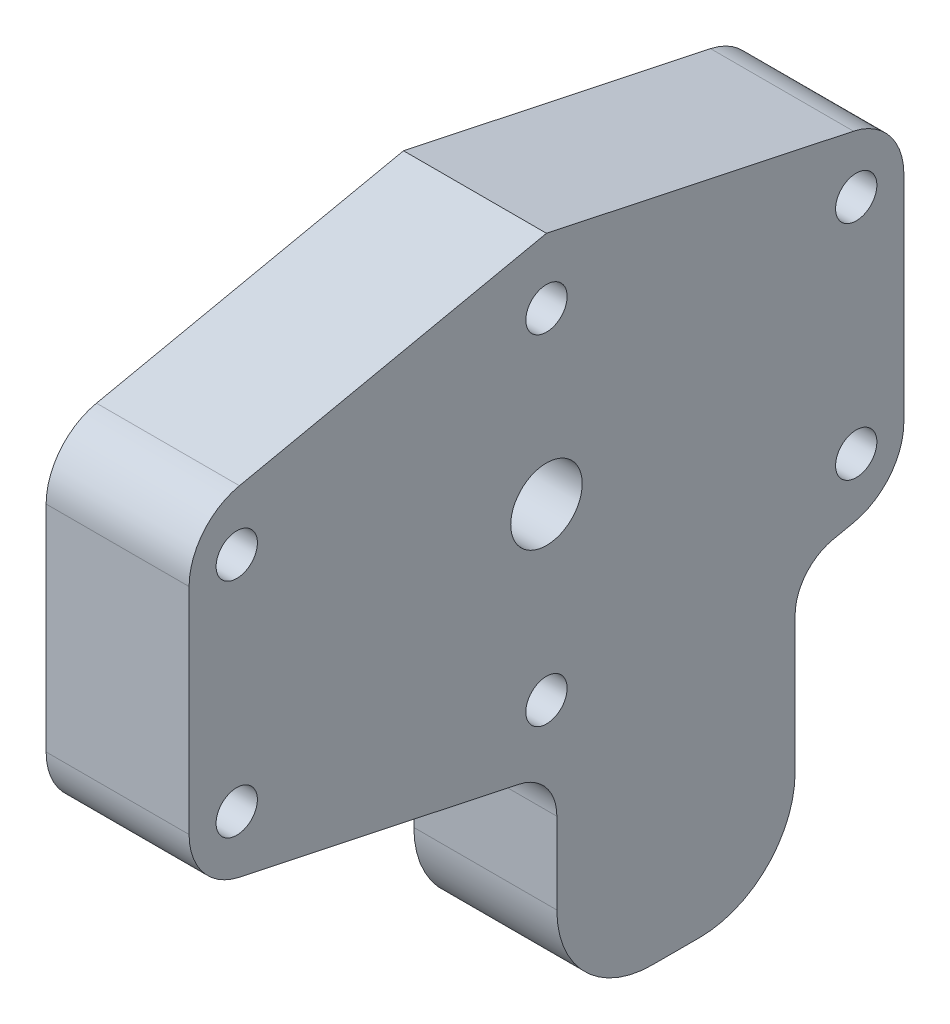
from build123d import *

# Parameters (mm, degrees)
SKETCH1_R           = 1.3
BOSS_EXTRUDE1_DEPTH = 9
CUT_REVOLVE3_ANGLE  = 180
SKETCH8_R           = 8.1
CUT_EXTRUDE4_DEPTH  = 5.5
SKETCH9_R           = 2.25
CUT_EXTRUDE5_DEPTH  = 52.660312042
BOSS_EXTRUDE7_DEPTH = 9
CUT_REVOLVE4_ANGLE  = 180
FILLET1_R           = 6
FILLET2_R           = 4
FILLET3_R           = 3
FILLET4_R           = 3


with BuildPart() as part:
    # Sketch1 → Boss-Extrude1 (new body)
    with BuildSketch(Plane(origin=(0, 0, 0), x_dir=(0, 0, -1), z_dir=(1, 0, 0))):
        Polygon((0, -20), (22.5, -24.769696007), (45, -20), (45, 0), (22.5, 4.769696007), (0, 0), align=None)
        with Locations((22.5, -20.680807118)):
            Circle(SKETCH1_R, mode=Mode.SUBTRACT)
        with Locations((22.5, 0.680807118)):
            Circle(SKETCH1_R, mode=Mode.SUBTRACT)
        with Locations((42, -17)):
            Circle(SKETCH1_R, mode=Mode.SUBTRACT)
        with Locations((3, -17)):
            Circle(SKETCH1_R, mode=Mode.SUBTRACT)
        with Locations((3, -3)):
            Circle(SKETCH1_R, mode=Mode.SUBTRACT)
        with Locations((42, -3)):
            Circle(SKETCH1_R, mode=Mode.SUBTRACT)
    extrude(amount=BOSS_EXTRUDE1_DEPTH)

    # Sketch7 → Cut-Revolve3 (revolve, cut)
    with BuildSketch(Plane.ZY):
        with BuildLine():
            Line((-41.7, -10), (-31.3, -10))
            ThreePointArc((-31.3, -10), (-36.5, -4.8), (-41.7, -10))
        make_face()
        with BuildLine():
            Line((-13.7, -10), (-3.3, -10))
            ThreePointArc((-3.3, -10), (-8.5, -4.8), (-13.7, -10))
        make_face()
    revolve(axis=Axis((0, -10, -41.7), (0, 0, -1)), revolution_arc=CUT_REVOLVE3_ANGLE, mode=Mode.SUBTRACT)

    # Sketch8 → Cut-Extrude4 (cut)
    with BuildSketch(Plane.ZY):
        with Locations((-22.5, -10)):
            Circle(SKETCH8_R)
    extrude(amount=-CUT_EXTRUDE4_DEPTH, mode=Mode.SUBTRACT)

    # Sketch9 → Cut-Extrude5 (cut, through all)
    with BuildSketch(Plane.ZY.offset(-5.5)):
        with Locations((-22.5, -10)):
            Circle(SKETCH9_R)
    extrude(amount=-CUT_EXTRUDE5_DEPTH, mode=Mode.SUBTRACT)

    # Sketch16 → Boss-Extrude7 (add)
    with BuildSketch(Plane(origin=(9, 0, 0), x_dir=(0, 0, -1), z_dir=(1, 0, 0))):
        Polygon((38.152173913, -21.451646611), (38.152173913, -38.451646611), (23.152173913, -38.451646611), (23.152173913, -24.631443949), align=None)
    extrude(amount=-BOSS_EXTRUDE7_DEPTH)

    # Sketch17 → Cut-Revolve4 (revolve, cut)
    with BuildSketch(Plane.ZY):
        with BuildLine():
            Line((-25.452173913, -30.451646611), (-35.852173913, -30.451646611))
            ThreePointArc((-35.852173913, -30.451646611), (-30.652173913, -25.251646611), (-25.452173913, -30.451646611))
        make_face()
    revolve(axis=Axis((0, -30.451646611, -25.452173913), (0, 0, -1)), revolution_arc=CUT_REVOLVE4_ANGLE, mode=Mode.SUBTRACT)

    # Fillet1
    fillet1_edges = [part.edges().sort_by_distance(p)[0] for p in [
        (4.5, -38.451646611, -38.152173913),
        (4.5, -38.451646611, -23.152173913),
    ]]
    fillet(fillet1_edges, radius=FILLET1_R)

    # Fillet2
    fillet2_edges = [part.edges().sort_by_distance(p)[0] for p in [
        (4.5, -20, -45),
        (4.5, -20, 0),
        (4.5, 0, 0),
        (4.5, 0, -45),
    ]]
    fillet(fillet2_edges, radius=FILLET2_R)

    # Fillet3
    # the kernel refuses this fillet: 3 mm, written as the material it adds along each edge
    with BuildSketch(Plane(origin=(9, -24.631443949, -23.152173913), x_dir=(0, -0.20737808726534282, 0.9782608695650501), z_dir=(-1, 0, 0))) as fillet3_piece_1:
        with BuildLine():
            CenterArc((3.350740319, -1.340055458), FILLET3_R, 153.468795145, 38.499950409)
            Line((0.41595771, -1.96218972), (0.357262058, -1.974632405))
            Line((0.357262058, -1.974632405), (-0.058695652, -0.012442685))
            Line((-0.058695652, -0.012442685), (0, 0.06))
            ThreePointArc((0, 0.06), (0.333333333, 0.06), (0.612985194, 0.026801109))
            Line((0.612985194, 0.026801109), (0.666666667, 0))
        make_face()
    extrude(amount=9)
    with BuildSketch(Plane(origin=(9, -21.451646611, -38.152173913), x_dir=(0, -1, 0), z_dir=(-1, 0, 0))) as fillet3_piece_2:
        with BuildLine():
            CenterArc((FILLET3_R * 0.810235733018, -FILLET3_R), FILLET3_R, 90, 78.031254445)
            Line((-FILLET3_R * 0.168025136547, -FILLET3_R * 0.792621912735), (-FILLET3_R * 0.187590353938, -FILLET3_R * 0.78847435099))
            Line((-FILLET3_R * 0.187590353938, -FILLET3_R * 0.78847435099), (-FILLET3_R * 0.0162047146604, FILLET3_R * 0.02))
            Line((-FILLET3_R * 0.0162047146604, FILLET3_R * 0.02), (FILLET3_R * 0.810235733018, FILLET3_R * 0.02))
            Line((FILLET3_R * 0.810235733018, FILLET3_R * 0.02), (FILLET3_R * 0.810235733018, 0))
        make_face()
    extrude(amount=9)

    # Fillet4
    fillet4_edges = [part.edges().sort_by_distance(p)[0] for p in [
        (4.5, -24.769696007, -22.5),
    ]]
    fillet(fillet4_edges, radius=FILLET4_R)


solid = part.part
